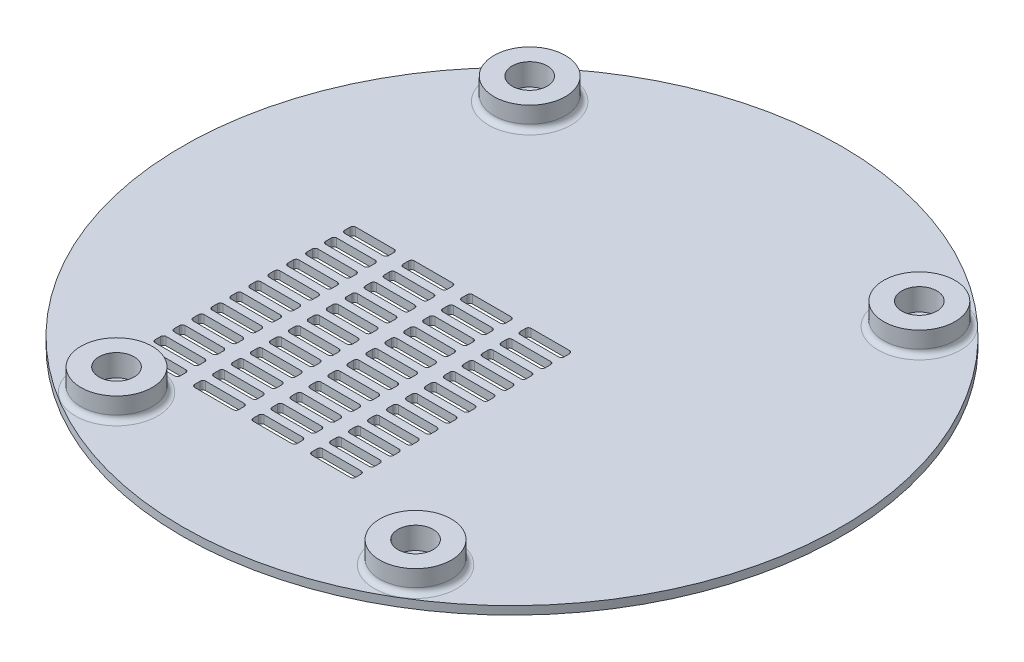
from build123d import *

# Parameters (mm, degrees)
SKETCH_1_R          = 60
SKETCH_1_R_2        = 1.6
EXTRUDE_1_DEPTH     = 1.5
CHAMFER_1_SIZE      = 1.6
SKETCH_2_R          = 6.5
SKETCH_2_R_2        = 3.2
EXTRUDE_2_DEPTH     = 4
FILLET_1_R          = 1
CUT_EXTRUDE_1_DEPTH = 85.947042326


with BuildPart() as part:
    # Эскиз1 → Бобышка-Вытянуть1 (new body)
    with BuildSketch(Plane(origin=(0, 0, 0), x_dir=(1, 0, 0), z_dir=(0, 1, 0))):
        with Locations(Location((0, 0, 0), (0, 0, 270))):
            Circle(SKETCH_1_R)
        with Locations(Location((-35.47, 38.69, 0), (0, 0, 270))):
            Circle(SKETCH_1_R_2, mode=Mode.SUBTRACT)
        with Locations(Location((35.47, 38.69, 0), (0, 0, 90))):
            Circle(SKETCH_1_R_2, mode=Mode.SUBTRACT)
        with Locations(Location((-27.22, -44.78, 0), (0, 0, 270))):
            Circle(SKETCH_1_R_2, mode=Mode.SUBTRACT)
        with Locations(Location((27.22, -44.78, 0), (0, 0, 90))):
            Circle(SKETCH_1_R_2, mode=Mode.SUBTRACT)
    extrude(amount=EXTRUDE_1_DEPTH)

    # Фаска1
    # the kernel refuses this chamfer: 1.6 mm, written as the material it takes off along each edge
    with BuildSketch(Plane(origin=(27.22, 1.5, 44.78), x_dir=(0, 0, -1), z_dir=(1, 0, 0))) as chamfer_1_piece_1:
        Polygon((1.6, -CHAMFER_1_SIZE), (1.6 + CHAMFER_1_SIZE, 0), (1.6, 0), align=None)
    revolve(axis=Axis((27.22, 1.5, 44.78), (0, 1, 0)), mode=Mode.SUBTRACT)
    with BuildSketch(Plane(origin=(35.47, 1.5, -38.69), x_dir=(0, 0, -1), z_dir=(1, 0, 0))) as chamfer_1_piece_2:
        Polygon((1.6, -CHAMFER_1_SIZE), (1.6 + CHAMFER_1_SIZE, 0), (1.6, 0), align=None)
    revolve(axis=Axis((35.47, 1.5, -38.69), (0, 1, 0)), mode=Mode.SUBTRACT)
    with BuildSketch(Plane(origin=(-35.47, 1.5, -38.69), x_dir=(0, 0, 1), z_dir=(-1, 0, 0))) as chamfer_1_piece_3:
        Polygon((1.6, -CHAMFER_1_SIZE), (1.6 + CHAMFER_1_SIZE, 0), (1.6, 0), align=None)
    revolve(axis=Axis((-35.47, 1.5, -38.69), (0, 1, 0)), mode=Mode.SUBTRACT)
    with BuildSketch(Plane(origin=(-27.22, 1.5, 44.78), x_dir=(0, 0, 1), z_dir=(-1, 0, 0))) as chamfer_1_piece_4:
        Polygon((1.6, -CHAMFER_1_SIZE), (1.6 + CHAMFER_1_SIZE, 0), (1.6, 0), align=None)
    revolve(axis=Axis((-27.22, 1.5, 44.78), (0, 1, 0)), mode=Mode.SUBTRACT)

    # Эскиз2 → Бобышка-Вытянуть2 (add)
    # profile 1 of 4: a face of its own
    with BuildSketch(Plane(origin=(0, 1.5, 0), x_dir=(1, 0, 0), z_dir=(0, 1, 0))):
        with Locations(Location((-35.47, 38.69, 0), (0, 0, 270))):
            Circle(SKETCH_2_R)
        with Locations(Location((-35.47, 38.69, 0), (0, 0, 270))):
            Circle(SKETCH_2_R_2, mode=Mode.SUBTRACT)
    # profile 2 of 4: a face of its own
    with BuildSketch(Plane(origin=(0, 1.5, 0), x_dir=(1, 0, 0), z_dir=(0, 1, 0))):
        with Locations(Location((35.47, 38.69, 0), (0, 0, 270))):
            Circle(SKETCH_2_R)
        with Locations(Location((35.47, 38.69, 0), (0, 0, 270))):
            Circle(SKETCH_2_R_2, mode=Mode.SUBTRACT)
    # profile 3 of 4: a face of its own
    with BuildSketch(Plane(origin=(0, 1.5, 0), x_dir=(1, 0, 0), z_dir=(0, 1, 0))):
        with Locations(Location((27.22, -44.78, 0), (0, 0, 270))):
            Circle(SKETCH_2_R)
        with Locations(Location((27.22, -44.78, 0), (0, 0, 270))):
            Circle(SKETCH_2_R_2, mode=Mode.SUBTRACT)
    # profile 4 of 4: a face of its own
    with BuildSketch(Plane(origin=(0, 1.5, 0), x_dir=(1, 0, 0), z_dir=(0, 1, 0))):
        with Locations(Location((-27.22, -44.78, 0), (0, 0, 270))):
            Circle(SKETCH_2_R)
        with Locations(Location((-27.22, -44.78, 0), (0, 0, 270))):
            Circle(SKETCH_2_R_2, mode=Mode.SUBTRACT)
    extrude(amount=EXTRUDE_2_DEPTH)

    # Скругление1
    fillet_1_edges = [part.edges().sort_by_distance(p)[0] for p in [
        (-27.22, 1.5, 38.28),
        (27.22, 1.5, 38.28),
        (35.47, 1.5, -45.19),
        (-35.47, 1.5, -45.19),
    ]]
    fillet(fillet_1_edges, radius=FILLET_1_R)

    # Эскиз3 → Вырез-Вытянуть1 (cut, through all)
    with BuildSketch(Plane(origin=(0, 1.5, 0), x_dir=(1, 0, 0), z_dir=(0, 1, 0))):
        with BuildLine():
            Line((-20.85, 3.04), (-13.85, 3.04))
            ThreePointArc((-13.85, 3.04), (-13.496446609, 2.893553391), (-13.35, 2.54))
            Line((-13.35, 2.54), (-13.35, 1.54))
            ThreePointArc((-13.35, 1.54), (-13.496446609, 1.186446609), (-13.85, 1.04))
            Line((-13.85, 1.04), (-20.85, 1.04))
            ThreePointArc((-20.85, 1.04), (-21.203553391, 1.186446609), (-21.35, 1.54))
            Line((-21.35, 1.54), (-21.35, 2.54))
            ThreePointArc((-21.35, 2.54), (-21.203553391, 2.893553391), (-20.85, 3.04))
        make_face()
        with BuildLine():
            Line((-31.5, 3.04), (-24.5, 3.04))
            ThreePointArc((-24.5, 3.04), (-24.146446609, 2.893553391), (-24, 2.54))
            Line((-24, 2.54), (-24, 1.54))
            ThreePointArc((-24, 1.54), (-24.146446609, 1.186446609), (-24.5, 1.04))
            Line((-24.5, 1.04), (-31.5, 1.04))
            ThreePointArc((-31.5, 1.04), (-31.853553391, 1.186446609), (-32, 1.54))
            Line((-32, 1.54), (-32, 2.54))
            ThreePointArc((-32, 2.54), (-31.853553391, 2.893553391), (-31.5, 3.04))
        make_face()
        with BuildLine():
            Line((-10.2, 3.04), (-3.2, 3.04))
            ThreePointArc((-3.2, 3.04), (-2.846446609, 2.893553391), (-2.7, 2.54))
            Line((-2.7, 2.54), (-2.7, 1.54))
            ThreePointArc((-2.7, 1.54), (-2.846446609, 1.186446609), (-3.2, 1.04))
            Line((-3.2, 1.04), (-10.2, 1.04))
            ThreePointArc((-10.2, 1.04), (-10.553553391, 1.186446609), (-10.7, 1.54))
            Line((-10.7, 1.54), (-10.7, 2.54))
            ThreePointArc((-10.7, 2.54), (-10.553553391, 2.893553391), (-10.2, 3.04))
        make_face()
        with BuildLine():
            Line((0.45, 3.04), (7.45, 3.04))
            ThreePointArc((7.45, 3.04), (7.803553391, 2.893553391), (7.95, 2.54))
            Line((7.95, 2.54), (7.95, 1.54))
            ThreePointArc((7.95, 1.54), (7.803553391, 1.186446609), (7.45, 1.04))
            Line((7.45, 1.04), (0.45, 1.04))
            ThreePointArc((0.45, 1.04), (0.096446609, 1.186446609), (-0.05, 1.54))
            Line((-0.05, 1.54), (-0.05, 2.54))
            ThreePointArc((-0.05, 2.54), (0.096446609, 2.893553391), (0.45, 3.04))
        make_face()
        with BuildLine():
            Line((-20.85, -0.41), (-13.85, -0.41))
            ThreePointArc((-13.85, -0.41), (-13.496446609, -0.556446609), (-13.35, -0.91))
            Line((-13.35, -0.91), (-13.35, -1.91))
            ThreePointArc((-13.35, -1.91), (-13.496446609, -2.263553391), (-13.85, -2.41))
            Line((-13.85, -2.41), (-20.85, -2.41))
            ThreePointArc((-20.85, -2.41), (-21.203553391, -2.263553391), (-21.35, -1.91))
            Line((-21.35, -1.91), (-21.35, -0.91))
            ThreePointArc((-21.35, -0.91), (-21.203553391, -0.556446609), (-20.85, -0.41))
        make_face()
        with BuildLine():
            Line((-10.2, -0.41), (-3.2, -0.41))
            ThreePointArc((-3.2, -0.41), (-2.846446609, -0.556446609), (-2.7, -0.91))
            Line((-2.7, -0.91), (-2.7, -1.91))
            ThreePointArc((-2.7, -1.91), (-2.846446609, -2.263553391), (-3.2, -2.41))
            Line((-3.2, -2.41), (-10.2, -2.41))
            ThreePointArc((-10.2, -2.41), (-10.553553391, -2.263553391), (-10.7, -1.91))
            Line((-10.7, -1.91), (-10.7, -0.91))
            ThreePointArc((-10.7, -0.91), (-10.553553391, -0.556446609), (-10.2, -0.41))
        make_face()
        with BuildLine():
            Line((0.45, -0.41), (7.45, -0.41))
            ThreePointArc((7.45, -0.41), (7.803553391, -0.556446609), (7.95, -0.91))
            Line((7.95, -0.91), (7.95, -1.91))
            ThreePointArc((7.95, -1.91), (7.803553391, -2.263553391), (7.45, -2.41))
            Line((7.45, -2.41), (0.45, -2.41))
            ThreePointArc((0.45, -2.41), (0.096446609, -2.263553391), (-0.05, -1.91))
            Line((-0.05, -1.91), (-0.05, -0.91))
            ThreePointArc((-0.05, -0.91), (0.096446609, -0.556446609), (0.45, -0.41))
        make_face()
        with BuildLine():
            Line((-20.85, -3.86), (-13.85, -3.86))
            ThreePointArc((-13.85, -3.86), (-13.496446609, -4.006446609), (-13.35, -4.36))
            Line((-13.35, -4.36), (-13.35, -5.36))
            ThreePointArc((-13.35, -5.36), (-13.496446609, -5.713553391), (-13.85, -5.86))
            Line((-13.85, -5.86), (-20.85, -5.86))
            ThreePointArc((-20.85, -5.86), (-21.203553391, -5.713553391), (-21.35, -5.36))
            Line((-21.35, -5.36), (-21.35, -4.36))
            ThreePointArc((-21.35, -4.36), (-21.203553391, -4.006446609), (-20.85, -3.86))
        make_face()
        with BuildLine():
            Line((-10.2, -3.86), (-3.2, -3.86))
            ThreePointArc((-3.2, -3.86), (-2.846446609, -4.006446609), (-2.7, -4.36))
            Line((-2.7, -4.36), (-2.7, -5.36))
            ThreePointArc((-2.7, -5.36), (-2.846446609, -5.713553391), (-3.2, -5.86))
            Line((-3.2, -5.86), (-10.2, -5.86))
            ThreePointArc((-10.2, -5.86), (-10.553553391, -5.713553391), (-10.7, -5.36))
            Line((-10.7, -5.36), (-10.7, -4.36))
            ThreePointArc((-10.7, -4.36), (-10.553553391, -4.006446609), (-10.2, -3.86))
        make_face()
        with BuildLine():
            Line((0.45, -3.86), (7.45, -3.86))
            ThreePointArc((7.45, -3.86), (7.803553391, -4.006446609), (7.95, -4.36))
            Line((7.95, -4.36), (7.95, -5.36))
            ThreePointArc((7.95, -5.36), (7.803553391, -5.713553391), (7.45, -5.86))
            Line((7.45, -5.86), (0.45, -5.86))
            ThreePointArc((0.45, -5.86), (0.096446609, -5.713553391), (-0.05, -5.36))
            Line((-0.05, -5.36), (-0.05, -4.36))
            ThreePointArc((-0.05, -4.36), (0.096446609, -4.006446609), (0.45, -3.86))
        make_face()
        with BuildLine():
            Line((-20.85, -7.31), (-13.85, -7.31))
            ThreePointArc((-13.85, -7.31), (-13.496446609, -7.456446609), (-13.35, -7.81))
            Line((-13.35, -7.81), (-13.35, -8.81))
            ThreePointArc((-13.35, -8.81), (-13.496446609, -9.163553391), (-13.85, -9.31))
            Line((-13.85, -9.31), (-20.85, -9.31))
            ThreePointArc((-20.85, -9.31), (-21.203553391, -9.163553391), (-21.35, -8.81))
            Line((-21.35, -8.81), (-21.35, -7.81))
            ThreePointArc((-21.35, -7.81), (-21.203553391, -7.456446609), (-20.85, -7.31))
        make_face()
        with BuildLine():
            Line((-10.2, -7.31), (-3.2, -7.31))
            ThreePointArc((-3.2, -7.31), (-2.846446609, -7.456446609), (-2.7, -7.81))
            Line((-2.7, -7.81), (-2.7, -8.81))
            ThreePointArc((-2.7, -8.81), (-2.846446609, -9.163553391), (-3.2, -9.31))
            Line((-3.2, -9.31), (-10.2, -9.31))
            ThreePointArc((-10.2, -9.31), (-10.553553391, -9.163553391), (-10.7, -8.81))
            Line((-10.7, -8.81), (-10.7, -7.81))
            ThreePointArc((-10.7, -7.81), (-10.553553391, -7.456446609), (-10.2, -7.31))
        make_face()
        with BuildLine():
            Line((0.45, -7.31), (7.45, -7.31))
            ThreePointArc((7.45, -7.31), (7.803553391, -7.456446609), (7.95, -7.81))
            Line((7.95, -7.81), (7.95, -8.81))
            ThreePointArc((7.95, -8.81), (7.803553391, -9.163553391), (7.45, -9.31))
            Line((7.45, -9.31), (0.45, -9.31))
            ThreePointArc((0.45, -9.31), (0.096446609, -9.163553391), (-0.05, -8.81))
            Line((-0.05, -8.81), (-0.05, -7.81))
            ThreePointArc((-0.05, -7.81), (0.096446609, -7.456446609), (0.45, -7.31))
        make_face()
        with BuildLine():
            Line((-20.85, -10.76), (-13.85, -10.76))
            ThreePointArc((-13.85, -10.76), (-13.496446609, -10.906446609), (-13.35, -11.26))
            Line((-13.35, -11.26), (-13.35, -12.26))
            ThreePointArc((-13.35, -12.26), (-13.496446609, -12.613553391), (-13.85, -12.76))
            Line((-13.85, -12.76), (-20.85, -12.76))
            ThreePointArc((-20.85, -12.76), (-21.203553391, -12.613553391), (-21.35, -12.26))
            Line((-21.35, -12.26), (-21.35, -11.26))
            ThreePointArc((-21.35, -11.26), (-21.203553391, -10.906446609), (-20.85, -10.76))
        make_face()
        with BuildLine():
            Line((-10.2, -10.76), (-3.2, -10.76))
            ThreePointArc((-3.2, -10.76), (-2.846446609, -10.906446609), (-2.7, -11.26))
            Line((-2.7, -11.26), (-2.7, -12.26))
            ThreePointArc((-2.7, -12.26), (-2.846446609, -12.613553391), (-3.2, -12.76))
            Line((-3.2, -12.76), (-10.2, -12.76))
            ThreePointArc((-10.2, -12.76), (-10.553553391, -12.613553391), (-10.7, -12.26))
            Line((-10.7, -12.26), (-10.7, -11.26))
            ThreePointArc((-10.7, -11.26), (-10.553553391, -10.906446609), (-10.2, -10.76))
        make_face()
        with BuildLine():
            Line((0.45, -10.76), (7.45, -10.76))
            ThreePointArc((7.45, -10.76), (7.803553391, -10.906446609), (7.95, -11.26))
            Line((7.95, -11.26), (7.95, -12.26))
            ThreePointArc((7.95, -12.26), (7.803553391, -12.613553391), (7.45, -12.76))
            Line((7.45, -12.76), (0.45, -12.76))
            ThreePointArc((0.45, -12.76), (0.096446609, -12.613553391), (-0.05, -12.26))
            Line((-0.05, -12.26), (-0.05, -11.26))
            ThreePointArc((-0.05, -11.26), (0.096446609, -10.906446609), (0.45, -10.76))
        make_face()
        with BuildLine():
            Line((-20.85, -14.21), (-13.85, -14.21))
            ThreePointArc((-13.85, -14.21), (-13.496446609, -14.356446609), (-13.35, -14.71))
            Line((-13.35, -14.71), (-13.35, -15.71))
            ThreePointArc((-13.35, -15.71), (-13.496446609, -16.063553391), (-13.85, -16.21))
            Line((-13.85, -16.21), (-20.85, -16.21))
            ThreePointArc((-20.85, -16.21), (-21.203553391, -16.063553391), (-21.35, -15.71))
            Line((-21.35, -15.71), (-21.35, -14.71))
            ThreePointArc((-21.35, -14.71), (-21.203553391, -14.356446609), (-20.85, -14.21))
        make_face()
        with BuildLine():
            Line((-10.2, -14.21), (-3.2, -14.21))
            ThreePointArc((-3.2, -14.21), (-2.846446609, -14.356446609), (-2.7, -14.71))
            Line((-2.7, -14.71), (-2.7, -15.71))
            ThreePointArc((-2.7, -15.71), (-2.846446609, -16.063553391), (-3.2, -16.21))
            Line((-3.2, -16.21), (-10.2, -16.21))
            ThreePointArc((-10.2, -16.21), (-10.553553391, -16.063553391), (-10.7, -15.71))
            Line((-10.7, -15.71), (-10.7, -14.71))
            ThreePointArc((-10.7, -14.71), (-10.553553391, -14.356446609), (-10.2, -14.21))
        make_face()
        with BuildLine():
            Line((0.45, -14.21), (7.45, -14.21))
            ThreePointArc((7.45, -14.21), (7.803553391, -14.356446609), (7.95, -14.71))
            Line((7.95, -14.71), (7.95, -15.71))
            ThreePointArc((7.95, -15.71), (7.803553391, -16.063553391), (7.45, -16.21))
            Line((7.45, -16.21), (0.45, -16.21))
            ThreePointArc((0.45, -16.21), (0.096446609, -16.063553391), (-0.05, -15.71))
            Line((-0.05, -15.71), (-0.05, -14.71))
            ThreePointArc((-0.05, -14.71), (0.096446609, -14.356446609), (0.45, -14.21))
        make_face()
        with BuildLine():
            Line((-20.85, -17.66), (-13.85, -17.66))
            ThreePointArc((-13.85, -17.66), (-13.496446609, -17.806446609), (-13.35, -18.16))
            Line((-13.35, -18.16), (-13.35, -19.16))
            ThreePointArc((-13.35, -19.16), (-13.496446609, -19.513553391), (-13.85, -19.66))
            Line((-13.85, -19.66), (-20.85, -19.66))
            ThreePointArc((-20.85, -19.66), (-21.203553391, -19.513553391), (-21.35, -19.16))
            Line((-21.35, -19.16), (-21.35, -18.16))
            ThreePointArc((-21.35, -18.16), (-21.203553391, -17.806446609), (-20.85, -17.66))
        make_face()
        with BuildLine():
            Line((-10.2, -17.66), (-3.2, -17.66))
            ThreePointArc((-3.2, -17.66), (-2.846446609, -17.806446609), (-2.7, -18.16))
            Line((-2.7, -18.16), (-2.7, -19.16))
            ThreePointArc((-2.7, -19.16), (-2.846446609, -19.513553391), (-3.2, -19.66))
            Line((-3.2, -19.66), (-10.2, -19.66))
            ThreePointArc((-10.2, -19.66), (-10.553553391, -19.513553391), (-10.7, -19.16))
            Line((-10.7, -19.16), (-10.7, -18.16))
            ThreePointArc((-10.7, -18.16), (-10.553553391, -17.806446609), (-10.2, -17.66))
        make_face()
        with BuildLine():
            Line((0.45, -17.66), (7.45, -17.66))
            ThreePointArc((7.45, -17.66), (7.803553391, -17.806446609), (7.95, -18.16))
            Line((7.95, -18.16), (7.95, -19.16))
            ThreePointArc((7.95, -19.16), (7.803553391, -19.513553391), (7.45, -19.66))
            Line((7.45, -19.66), (0.45, -19.66))
            ThreePointArc((0.45, -19.66), (0.096446609, -19.513553391), (-0.05, -19.16))
            Line((-0.05, -19.16), (-0.05, -18.16))
            ThreePointArc((-0.05, -18.16), (0.096446609, -17.806446609), (0.45, -17.66))
        make_face()
        with BuildLine():
            Line((-20.85, -21.11), (-13.85, -21.11))
            ThreePointArc((-13.85, -21.11), (-13.496446609, -21.256446609), (-13.35, -21.61))
            Line((-13.35, -21.61), (-13.35, -22.61))
            ThreePointArc((-13.35, -22.61), (-13.496446609, -22.963553391), (-13.85, -23.11))
            Line((-13.85, -23.11), (-20.85, -23.11))
            ThreePointArc((-20.85, -23.11), (-21.203553391, -22.963553391), (-21.35, -22.61))
            Line((-21.35, -22.61), (-21.35, -21.61))
            ThreePointArc((-21.35, -21.61), (-21.203553391, -21.256446609), (-20.85, -21.11))
        make_face()
        with BuildLine():
            Line((-10.2, -21.11), (-3.2, -21.11))
            ThreePointArc((-3.2, -21.11), (-2.846446609, -21.256446609), (-2.7, -21.61))
            Line((-2.7, -21.61), (-2.7, -22.61))
            ThreePointArc((-2.7, -22.61), (-2.846446609, -22.963553391), (-3.2, -23.11))
            Line((-3.2, -23.11), (-10.2, -23.11))
            ThreePointArc((-10.2, -23.11), (-10.553553391, -22.963553391), (-10.7, -22.61))
            Line((-10.7, -22.61), (-10.7, -21.61))
            ThreePointArc((-10.7, -21.61), (-10.553553391, -21.256446609), (-10.2, -21.11))
        make_face()
        with BuildLine():
            Line((0.45, -21.11), (7.45, -21.11))
            ThreePointArc((7.45, -21.11), (7.803553391, -21.256446609), (7.95, -21.61))
            Line((7.95, -21.61), (7.95, -22.61))
            ThreePointArc((7.95, -22.61), (7.803553391, -22.963553391), (7.45, -23.11))
            Line((7.45, -23.11), (0.45, -23.11))
            ThreePointArc((0.45, -23.11), (0.096446609, -22.963553391), (-0.05, -22.61))
            Line((-0.05, -22.61), (-0.05, -21.61))
            ThreePointArc((-0.05, -21.61), (0.096446609, -21.256446609), (0.45, -21.11))
        make_face()
        with BuildLine():
            Line((-20.85, -24.56), (-13.85, -24.56))
            ThreePointArc((-13.85, -24.56), (-13.496446609, -24.706446609), (-13.35, -25.06))
            Line((-13.35, -25.06), (-13.35, -26.06))
            ThreePointArc((-13.35, -26.06), (-13.496446609, -26.413553391), (-13.85, -26.56))
            Line((-13.85, -26.56), (-20.85, -26.56))
            ThreePointArc((-20.85, -26.56), (-21.203553391, -26.413553391), (-21.35, -26.06))
            Line((-21.35, -26.06), (-21.35, -25.06))
            ThreePointArc((-21.35, -25.06), (-21.203553391, -24.706446609), (-20.85, -24.56))
        make_face()
        with BuildLine():
            Line((-10.2, -24.56), (-3.2, -24.56))
            ThreePointArc((-3.2, -24.56), (-2.846446609, -24.706446609), (-2.7, -25.06))
            Line((-2.7, -25.06), (-2.7, -26.06))
            ThreePointArc((-2.7, -26.06), (-2.846446609, -26.413553391), (-3.2, -26.56))
            Line((-3.2, -26.56), (-10.2, -26.56))
            ThreePointArc((-10.2, -26.56), (-10.553553391, -26.413553391), (-10.7, -26.06))
            Line((-10.7, -26.06), (-10.7, -25.06))
            ThreePointArc((-10.7, -25.06), (-10.553553391, -24.706446609), (-10.2, -24.56))
        make_face()
        with BuildLine():
            Line((0.45, -24.56), (7.45, -24.56))
            ThreePointArc((7.45, -24.56), (7.803553391, -24.706446609), (7.95, -25.06))
            Line((7.95, -25.06), (7.95, -26.06))
            ThreePointArc((7.95, -26.06), (7.803553391, -26.413553391), (7.45, -26.56))
            Line((7.45, -26.56), (0.45, -26.56))
            ThreePointArc((0.45, -26.56), (0.096446609, -26.413553391), (-0.05, -26.06))
            Line((-0.05, -26.06), (-0.05, -25.06))
            ThreePointArc((-0.05, -25.06), (0.096446609, -24.706446609), (0.45, -24.56))
        make_face()
        with BuildLine():
            Line((-20.85, -28.01), (-13.85, -28.01))
            ThreePointArc((-13.85, -28.01), (-13.496446609, -28.156446609), (-13.35, -28.51))
            Line((-13.35, -28.51), (-13.35, -29.51))
            ThreePointArc((-13.35, -29.51), (-13.496446609, -29.863553391), (-13.85, -30.01))
            Line((-13.85, -30.01), (-20.85, -30.01))
            ThreePointArc((-20.85, -30.01), (-21.203553391, -29.863553391), (-21.35, -29.51))
            Line((-21.35, -29.51), (-21.35, -28.51))
            ThreePointArc((-21.35, -28.51), (-21.203553391, -28.156446609), (-20.85, -28.01))
        make_face()
        with BuildLine():
            Line((-10.2, -28.01), (-3.2, -28.01))
            ThreePointArc((-3.2, -28.01), (-2.846446609, -28.156446609), (-2.7, -28.51))
            Line((-2.7, -28.51), (-2.7, -29.51))
            ThreePointArc((-2.7, -29.51), (-2.846446609, -29.863553391), (-3.2, -30.01))
            Line((-3.2, -30.01), (-10.2, -30.01))
            ThreePointArc((-10.2, -30.01), (-10.553553391, -29.863553391), (-10.7, -29.51))
            Line((-10.7, -29.51), (-10.7, -28.51))
            ThreePointArc((-10.7, -28.51), (-10.553553391, -28.156446609), (-10.2, -28.01))
        make_face()
        with BuildLine():
            Line((0.45, -28.01), (7.45, -28.01))
            ThreePointArc((7.45, -28.01), (7.803553391, -28.156446609), (7.95, -28.51))
            Line((7.95, -28.51), (7.95, -29.51))
            ThreePointArc((7.95, -29.51), (7.803553391, -29.863553391), (7.45, -30.01))
            Line((7.45, -30.01), (0.45, -30.01))
            ThreePointArc((0.45, -30.01), (0.096446609, -29.863553391), (-0.05, -29.51))
            Line((-0.05, -29.51), (-0.05, -28.51))
            ThreePointArc((-0.05, -28.51), (0.096446609, -28.156446609), (0.45, -28.01))
        make_face()
        with BuildLine():
            Line((-20.85, -31.46), (-13.85, -31.46))
            ThreePointArc((-13.85, -31.46), (-13.496446609, -31.606446609), (-13.35, -31.96))
            Line((-13.35, -31.96), (-13.35, -32.96))
            ThreePointArc((-13.35, -32.96), (-13.496446609, -33.313553391), (-13.85, -33.46))
            Line((-13.85, -33.46), (-20.85, -33.46))
            ThreePointArc((-20.85, -33.46), (-21.203553391, -33.313553391), (-21.35, -32.96))
            Line((-21.35, -32.96), (-21.35, -31.96))
            ThreePointArc((-21.35, -31.96), (-21.203553391, -31.606446609), (-20.85, -31.46))
        make_face()
        with BuildLine():
            Line((-10.2, -31.46), (-3.2, -31.46))
            ThreePointArc((-3.2, -31.46), (-2.846446609, -31.606446609), (-2.7, -31.96))
            Line((-2.7, -31.96), (-2.7, -32.96))
            ThreePointArc((-2.7, -32.96), (-2.846446609, -33.313553391), (-3.2, -33.46))
            Line((-3.2, -33.46), (-10.2, -33.46))
            ThreePointArc((-10.2, -33.46), (-10.553553391, -33.313553391), (-10.7, -32.96))
            Line((-10.7, -32.96), (-10.7, -31.96))
            ThreePointArc((-10.7, -31.96), (-10.553553391, -31.606446609), (-10.2, -31.46))
        make_face()
        with BuildLine():
            Line((0.45, -31.46), (7.45, -31.46))
            ThreePointArc((7.45, -31.46), (7.803553391, -31.606446609), (7.95, -31.96))
            Line((7.95, -31.96), (7.95, -32.96))
            ThreePointArc((7.95, -32.96), (7.803553391, -33.313553391), (7.45, -33.46))
            Line((7.45, -33.46), (0.45, -33.46))
            ThreePointArc((0.45, -33.46), (0.096446609, -33.313553391), (-0.05, -32.96))
            Line((-0.05, -32.96), (-0.05, -31.96))
            ThreePointArc((-0.05, -31.96), (0.096446609, -31.606446609), (0.45, -31.46))
        make_face()
        with BuildLine():
            Line((-20.85, -34.91), (-13.85, -34.91))
            ThreePointArc((-13.85, -34.91), (-13.496446609, -35.056446609), (-13.35, -35.41))
            Line((-13.35, -35.41), (-13.35, -36.41))
            ThreePointArc((-13.35, -36.41), (-13.496446609, -36.763553391), (-13.85, -36.91))
            Line((-13.85, -36.91), (-20.85, -36.91))
            ThreePointArc((-20.85, -36.91), (-21.203553391, -36.763553391), (-21.35, -36.41))
            Line((-21.35, -36.41), (-21.35, -35.41))
            ThreePointArc((-21.35, -35.41), (-21.203553391, -35.056446609), (-20.85, -34.91))
        make_face()
        with BuildLine():
            Line((-10.2, -34.91), (-3.2, -34.91))
            ThreePointArc((-3.2, -34.91), (-2.846446609, -35.056446609), (-2.7, -35.41))
            Line((-2.7, -35.41), (-2.7, -36.41))
            ThreePointArc((-2.7, -36.41), (-2.846446609, -36.763553391), (-3.2, -36.91))
            Line((-3.2, -36.91), (-10.2, -36.91))
            ThreePointArc((-10.2, -36.91), (-10.553553391, -36.763553391), (-10.7, -36.41))
            Line((-10.7, -36.41), (-10.7, -35.41))
            ThreePointArc((-10.7, -35.41), (-10.553553391, -35.056446609), (-10.2, -34.91))
        make_face()
        with BuildLine():
            Line((0.45, -34.91), (7.45, -34.91))
            ThreePointArc((7.45, -34.91), (7.803553391, -35.056446609), (7.95, -35.41))
            Line((7.95, -35.41), (7.95, -36.41))
            ThreePointArc((7.95, -36.41), (7.803553391, -36.763553391), (7.45, -36.91))
            Line((7.45, -36.91), (0.45, -36.91))
            ThreePointArc((0.45, -36.91), (0.096446609, -36.763553391), (-0.05, -36.41))
            Line((-0.05, -36.41), (-0.05, -35.41))
            ThreePointArc((-0.05, -35.41), (0.096446609, -35.056446609), (0.45, -34.91))
        make_face()
        with BuildLine():
            Line((-31.5, -0.41), (-24.5, -0.41))
            ThreePointArc((-24.5, -0.41), (-24.146446609, -0.556446609), (-24, -0.91))
            Line((-24, -0.91), (-24, -1.91))
            ThreePointArc((-24, -1.91), (-24.146446609, -2.263553391), (-24.5, -2.41))
            Line((-24.5, -2.41), (-31.5, -2.41))
            ThreePointArc((-31.5, -2.41), (-31.853553391, -2.263553391), (-32, -1.91))
            Line((-32, -1.91), (-32, -0.91))
            ThreePointArc((-32, -0.91), (-31.853553391, -0.556446609), (-31.5, -0.41))
        make_face()
        with BuildLine():
            Line((-31.5, -3.86), (-24.5, -3.86))
            ThreePointArc((-24.5, -3.86), (-24.146446609, -4.006446609), (-24, -4.36))
            Line((-24, -4.36), (-24, -5.36))
            ThreePointArc((-24, -5.36), (-24.146446609, -5.713553391), (-24.5, -5.86))
            Line((-24.5, -5.86), (-31.5, -5.86))
            ThreePointArc((-31.5, -5.86), (-31.853553391, -5.713553391), (-32, -5.36))
            Line((-32, -5.36), (-32, -4.36))
            ThreePointArc((-32, -4.36), (-31.853553391, -4.006446609), (-31.5, -3.86))
        make_face()
        with BuildLine():
            Line((-31.5, -7.31), (-24.5, -7.31))
            ThreePointArc((-24.5, -7.31), (-24.146446609, -7.456446609), (-24, -7.81))
            Line((-24, -7.81), (-24, -8.81))
            ThreePointArc((-24, -8.81), (-24.146446609, -9.163553391), (-24.5, -9.31))
            Line((-24.5, -9.31), (-31.5, -9.31))
            ThreePointArc((-31.5, -9.31), (-31.853553391, -9.163553391), (-32, -8.81))
            Line((-32, -8.81), (-32, -7.81))
            ThreePointArc((-32, -7.81), (-31.853553391, -7.456446609), (-31.5, -7.31))
        make_face()
        with BuildLine():
            Line((-31.5, -10.76), (-24.5, -10.76))
            ThreePointArc((-24.5, -10.76), (-24.146446609, -10.906446609), (-24, -11.26))
            Line((-24, -11.26), (-24, -12.26))
            ThreePointArc((-24, -12.26), (-24.146446609, -12.613553391), (-24.5, -12.76))
            Line((-24.5, -12.76), (-31.5, -12.76))
            ThreePointArc((-31.5, -12.76), (-31.853553391, -12.613553391), (-32, -12.26))
            Line((-32, -12.26), (-32, -11.26))
            ThreePointArc((-32, -11.26), (-31.853553391, -10.906446609), (-31.5, -10.76))
        make_face()
        with BuildLine():
            Line((-31.5, -14.21), (-24.5, -14.21))
            ThreePointArc((-24.5, -14.21), (-24.146446609, -14.356446609), (-24, -14.71))
            Line((-24, -14.71), (-24, -15.71))
            ThreePointArc((-24, -15.71), (-24.146446609, -16.063553391), (-24.5, -16.21))
            Line((-24.5, -16.21), (-31.5, -16.21))
            ThreePointArc((-31.5, -16.21), (-31.853553391, -16.063553391), (-32, -15.71))
            Line((-32, -15.71), (-32, -14.71))
            ThreePointArc((-32, -14.71), (-31.853553391, -14.356446609), (-31.5, -14.21))
        make_face()
        with BuildLine():
            Line((-31.5, -17.66), (-24.5, -17.66))
            ThreePointArc((-24.5, -17.66), (-24.146446609, -17.806446609), (-24, -18.16))
            Line((-24, -18.16), (-24, -19.16))
            ThreePointArc((-24, -19.16), (-24.146446609, -19.513553391), (-24.5, -19.66))
            Line((-24.5, -19.66), (-31.5, -19.66))
            ThreePointArc((-31.5, -19.66), (-31.853553391, -19.513553391), (-32, -19.16))
            Line((-32, -19.16), (-32, -18.16))
            ThreePointArc((-32, -18.16), (-31.853553391, -17.806446609), (-31.5, -17.66))
        make_face()
        with BuildLine():
            Line((-31.5, -21.11), (-24.5, -21.11))
            ThreePointArc((-24.5, -21.11), (-24.146446609, -21.256446609), (-24, -21.61))
            Line((-24, -21.61), (-24, -22.61))
            ThreePointArc((-24, -22.61), (-24.146446609, -22.963553391), (-24.5, -23.11))
            Line((-24.5, -23.11), (-31.5, -23.11))
            ThreePointArc((-31.5, -23.11), (-31.853553391, -22.963553391), (-32, -22.61))
            Line((-32, -22.61), (-32, -21.61))
            ThreePointArc((-32, -21.61), (-31.853553391, -21.256446609), (-31.5, -21.11))
        make_face()
        with BuildLine():
            Line((-31.5, -24.56), (-24.5, -24.56))
            ThreePointArc((-24.5, -24.56), (-24.146446609, -24.706446609), (-24, -25.06))
            Line((-24, -25.06), (-24, -26.06))
            ThreePointArc((-24, -26.06), (-24.146446609, -26.413553391), (-24.5, -26.56))
            Line((-24.5, -26.56), (-31.5, -26.56))
            ThreePointArc((-31.5, -26.56), (-31.853553391, -26.413553391), (-32, -26.06))
            Line((-32, -26.06), (-32, -25.06))
            ThreePointArc((-32, -25.06), (-31.853553391, -24.706446609), (-31.5, -24.56))
        make_face()
        with BuildLine():
            Line((-31.5, -28.01), (-24.5, -28.01))
            ThreePointArc((-24.5, -28.01), (-24.146446609, -28.156446609), (-24, -28.51))
            Line((-24, -28.51), (-24, -29.51))
            ThreePointArc((-24, -29.51), (-24.146446609, -29.863553391), (-24.5, -30.01))
            Line((-24.5, -30.01), (-31.5, -30.01))
            ThreePointArc((-31.5, -30.01), (-31.853553391, -29.863553391), (-32, -29.51))
            Line((-32, -29.51), (-32, -28.51))
            ThreePointArc((-32, -28.51), (-31.853553391, -28.156446609), (-31.5, -28.01))
        make_face()
        with BuildLine():
            Line((-31.5, -31.46), (-24.5, -31.46))
            ThreePointArc((-24.5, -31.46), (-24.146446609, -31.606446609), (-24, -31.96))
            Line((-24, -31.96), (-24, -32.96))
            ThreePointArc((-24, -32.96), (-24.146446609, -33.313553391), (-24.5, -33.46))
            Line((-24.5, -33.46), (-31.5, -33.46))
            ThreePointArc((-31.5, -33.46), (-31.853553391, -33.313553391), (-32, -32.96))
            Line((-32, -32.96), (-32, -31.96))
            ThreePointArc((-32, -31.96), (-31.853553391, -31.606446609), (-31.5, -31.46))
        make_face()
        with BuildLine():
            Line((-31.5, -34.91), (-24.5, -34.91))
            ThreePointArc((-24.5, -34.91), (-24.146446609, -35.056446609), (-24, -35.41))
            Line((-24, -35.41), (-24, -36.41))
            ThreePointArc((-24, -36.41), (-24.146446609, -36.763553391), (-24.5, -36.91))
            Line((-24.5, -36.91), (-31.5, -36.91))
            ThreePointArc((-31.5, -36.91), (-31.853553391, -36.763553391), (-32, -36.41))
            Line((-32, -36.41), (-32, -35.41))
            ThreePointArc((-32, -35.41), (-31.853553391, -35.056446609), (-31.5, -34.91))
        make_face()
    extrude(amount=-CUT_EXTRUDE_1_DEPTH, mode=Mode.SUBTRACT)


solid = part.part
